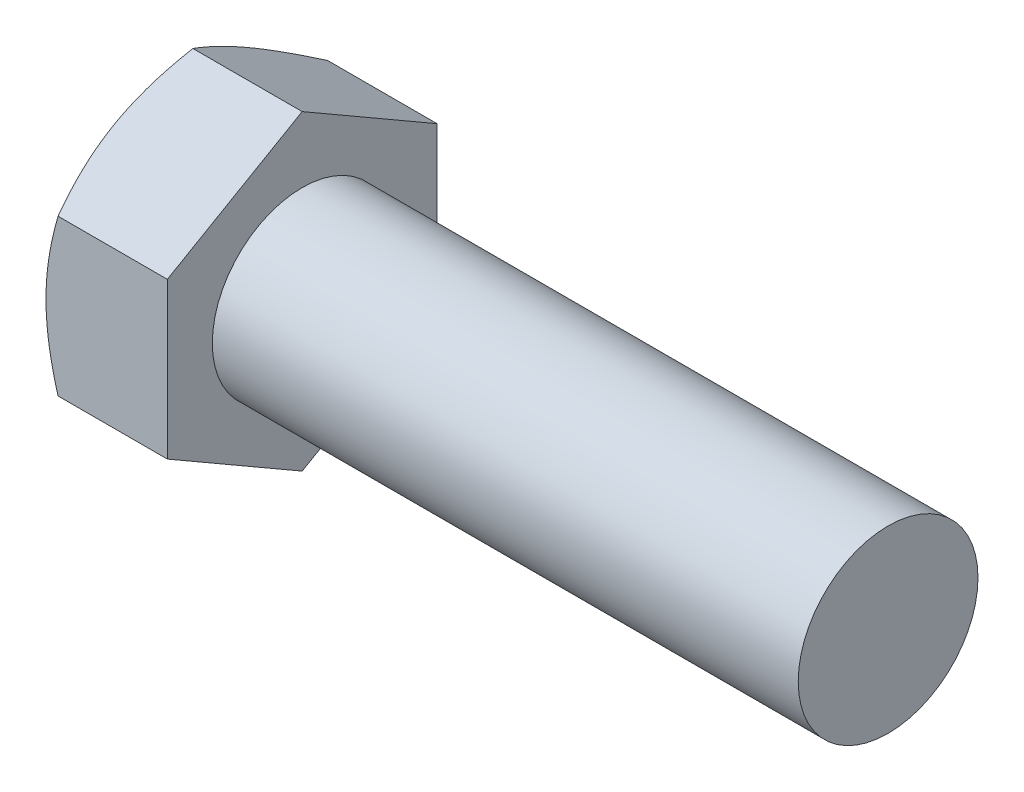
from build123d import *

# Parameters (mm, degrees)
SKETCH5_R           = 7.9375
BOSS_EXTRUDE3_DEPTH = 50.8
CHAMFER1_SIZE       = 1.731818182
CUT_SWEEP1_PITCH    = 2.309090909
BOSS_EXTRUDE4_DEPTH = 10.715625
SKETCH8_OUTSIDE_W   = 265.784
SKETCH8_OUTSIDE_H   = 269.468
SKETCH8_OUTSIDE_R   = 11.90625
CUT_EXTRUDE3_DEPTH  = 65.147818703
CUT_EXTRUDE3_DRAFT  = -60
CUT_EXTRUDE4_DEPTH  = 0.254
CIRPATTERN1_COUNT   = 6
SKETCH13_R          = 7.9375
BOSS_EXTRUDE5_DEPTH = 51.741567


with BuildPart() as part:
    # Sketch5 → Boss-Extrude3 (new body)
    with BuildSketch(Plane(origin=(30.7578125, 0, 0), x_dir=(0, 0, -1), z_dir=(1, 0, 0))):
        Circle(SKETCH5_R)
    extrude(amount=-BOSS_EXTRUDE3_DEPTH)

    # Chamfer1
    chamfer1_edges = [part.edges().sort_by_distance(p)[0] for p in [
        (30.7578125, 0, 7.9375),
    ]]
    chamfer(chamfer1_edges, length=CHAMFER1_SIZE)

    # Cut-Sweep1: arcs per turn and ends read off the stored shape
    # Cut-Sweep1: the profile of Sketch10 profile screwed along a right-hand helix through 23 turns, 10 arcs to a turn; built about Z, then put on its axis
    cut_sweep1_z = Axis((0, 0, 0), (0, 0, 1))
    cut_sweep1_corners = [(7.9378, 0, 0.000173205), (6.43770146, 0, -0.865909091), (6.43770146, 0, -1.154545455), (7.9378, 0, -2.020627751)]
    with BuildLine(mode=Mode.PRIVATE) as cut_sweep1_profile:
        Line(cut_sweep1_corners[0], cut_sweep1_corners[1])
        Line(cut_sweep1_corners[1], cut_sweep1_corners[2])
        Line(cut_sweep1_corners[2], cut_sweep1_corners[3])
        Line(cut_sweep1_corners[3], cut_sweep1_corners[0])
    cut_sweep1_cap = Face(cut_sweep1_profile.wire())
    cut_sweep1_turn_angles = [0, 18, 36, 54, 72, 90, 108, 126, 144, 162, 180, 198, 216, 234, 252, 270, 288, 306, 324, 342, 360]
    cut_sweep1_turn_weights = [1, 0.9510565162951535, 1, 0.9510565162951535, 1, 0.9510565162951535, 1, 0.9510565162951535, 1, 0.9510565162951535, 1, 0.9510565162951535, 1, 0.9510565162951535, 1, 0.9510565162951535, 1, 0.9510565162951535, 1, 0.9510565162951535, 1]
    cut_sweep1_turn_rails = [Edge.make_bspline([Vector(p[0], p[1], 0).rotate(cut_sweep1_z, cut_sweep1_turn_angles[k]) / cut_sweep1_turn_weights[k] + Vector(0, 0, p[2] + CUT_SWEEP1_PITCH * cut_sweep1_turn_angles[k] / 360) for k in range(21)], [0, 0, 0, 1, 1, 2, 2, 3, 3, 4, 4, 5, 5, 6, 6, 7, 7, 8, 8, 9, 9, 10, 10, 10], 2, cut_sweep1_turn_weights) for p in cut_sweep1_corners]
    cut_sweep1_turn_sides = [Face.make_surface_from_curves(cut_sweep1_turn_rails[p[0]], cut_sweep1_turn_rails[p[1]]) for p in [(0, 1), (1, 2), (2, 3), (3, 0)]]
    cut_sweep1 = Plane(origin=(30.7578125, 0, 0), x_dir=(0, 1, 0), z_dir=(-1, 0, 0)) * Solid(Shell([*[p.moved(Location((0, 0, CUT_SWEEP1_PITCH * i))) for i in range(23) for p in cut_sweep1_turn_sides], cut_sweep1_cap, cut_sweep1_cap.rotate(cut_sweep1_z, 8280).moved(Location((0, 0, CUT_SWEEP1_PITCH * 8280 / 360)))]))
    add(cut_sweep1, mode=Mode.SUBTRACT)

    # Sketch6 → Boss-Extrude4 (add)
    with BuildSketch(Plane.ZY.offset(20.0421875)):
        Polygon((11.90625, 6.874076643), (0, 13.748153285), (-11.90625, 6.874076643), (-11.90625, -6.874076643), (0, -13.748153285), (11.90625, -6.874076643), align=None)
    extrude(amount=BOSS_EXTRUDE4_DEPTH)


with BuildPart() as cut_extrude3_tool:
    # Sketch8 outside → Cut-Extrude3 (with draft: the straight prism first)
    with BuildSketch(Plane.ZY.offset(30.7578125)):
        Rectangle(SKETCH8_OUTSIDE_W, SKETCH8_OUTSIDE_H)
        Circle(SKETCH8_OUTSIDE_R, mode=Mode.SUBTRACT)
    extrude(amount=-CUT_EXTRUDE3_DEPTH)
    # Cut-Extrude3: the draft: its side faces are tilted about the plane it starts from
    cut_extrude3_sides = [cut_extrude3_tool.faces().sort_by_distance(p)[0] for p in [
        (1.816096852, -134.734, 0),
        (1.816096852, 0, 132.892),
        (1.816096852, 134.734, 0),
        (1.816096852, 0, -132.892),
        (1.816096852, 0, -11.90625),
    ]]
    draft(cut_extrude3_sides, Plane.ZY.offset(30.7578125), CUT_EXTRUDE3_DRAFT)


with BuildPart() as part_1:
    add(part.part)

    # Cut-Extrude3: cut by cut_extrude3_tool
    add(cut_extrude3_tool.part, mode=Mode.SUBTRACT)

    # Sketch12 → Cut-Extrude4 (cut)
    with BuildSketch(Plane.ZY.offset(30.7578125)):
        with BuildLine():
            Line((0.3571875, 9.1678125), (0.3571875, 5.1196875))
            ThreePointArc((0.3571875, 5.1196875), (0, 4.7625), (-0.3571875, 5.1196875))
            Line((-0.3571875, 5.1196875), (-0.3571875, 9.1678125))
            ThreePointArc((-0.3571875, 9.1678125), (0, 9.525), (0.3571875, 9.1678125))
        make_face()
    cut_extrude4 = extrude(amount=-CUT_EXTRUDE4_DEPTH, mode=Mode.SUBTRACT)

    # CirPattern1: Cut-Extrude4 ×6 about axis
    cirpattern1_axis = Axis((0, 0, 0), (1, 0, 0))
    for i in range(1, CIRPATTERN1_COUNT):
        add(cut_extrude4.rotate(cirpattern1_axis, i * 360 / CIRPATTERN1_COUNT), mode=Mode.SUBTRACT)

    # Sketch13 → Boss-Extrude5 (add)
    with BuildSketch(Plane(origin=(-20.0421875, 0, 0), x_dir=(0, 0, -1), z_dir=(1, 0, 0))):
        Circle(SKETCH13_R)
    extrude(amount=BOSS_EXTRUDE5_DEPTH)


solid = part_1.part
